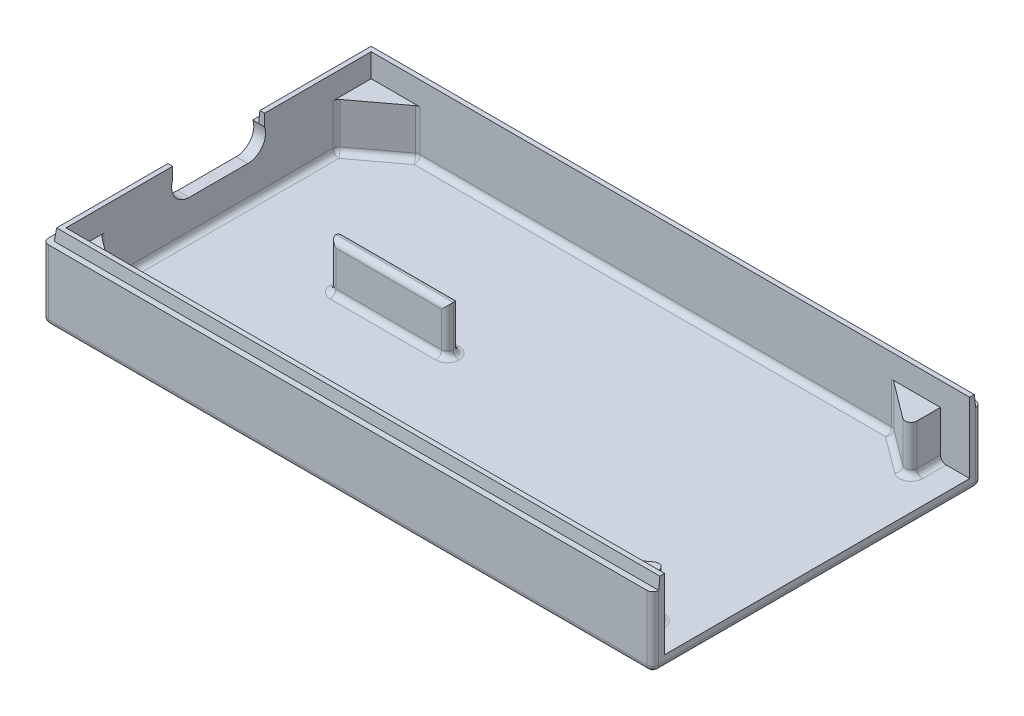
from build123d import *

# Parameters (mm, degrees)
SKETCH_1_W          = 52
SKETCH_1_H          = 28
EXTRUDE_1_DEPTH     = 6
SKETCH_3_W          = 51
SKETCH_3_H          = 26
CUT_EXTRUDE_1_DEPTH = 5
SKETCH_4_W          = 10
SKETCH_4_H          = 1
EXTRUDE_2_DEPTH     = 4
CUT_EXTRUDE_2_REACH = 56.185
FILLET_1_R          = 0.5
EXTRUDE_3_DEPTH     = 1
CHAMFER_1_SIZE      = 0.1
CHAMFER_1_SIZE_2    = 1


# Some blends are built 0.0001 mm under size
with BuildPart() as part:
    # Эскиз1 → Бобышка-Вытянуть1 (new body)
    with BuildSketch(Plane(origin=(0, 0, 0), x_dir=(1, 0, 0), z_dir=(0, 1, 0))):
        Rectangle(SKETCH_1_W, SKETCH_1_H)
    extrude(amount=EXTRUDE_1_DEPTH)

    # Эскиз3 → Вырез-Вытянуть1 (cut)
    with BuildSketch(Plane(origin=(0, 6, 0), x_dir=(1, 0, 0), z_dir=(0, 1, 0))):
        with Locations((0.5, 0)):
            Rectangle(SKETCH_3_W, SKETCH_3_H)
    extrude(amount=-CUT_EXTRUDE_1_DEPTH, mode=Mode.SUBTRACT)

    # Эскиз4 → Бобышка-Вытянуть2 (add)
    with BuildSketch(Plane(origin=(0, 1, 0), x_dir=(1, 0, 0), z_dir=(0, 1, 0))):
        Polygon((19.5, 13), (23.5, 10), (23.5, 13), align=None)
        Polygon((-25, 13), (-25, 10), (-21, 13), align=None)
        Polygon((-21, -13), (-25, -13), (-25, -10), align=None)
        Polygon((23.5, -13), (19.5, -13), (23.5, -10), align=None)
        with Locations((-10, 0)):
            Rectangle(SKETCH_4_W, SKETCH_4_H)
    extrude(amount=EXTRUDE_2_DEPTH)

    # Эскиз5 → Вырез-Вытянуть2 (cut, up to next)
    with BuildSketch(Plane.ZY.offset(26), mode=Mode.PRIVATE) as cut_extrude_2_sk1:
        with BuildLine():
            Line((2.5, 4), (-2.5, 4))
            ThreePointArc((-2.5, 4), (-4, 5.5), (-2.5, 7))
            Line((-2.5, 7), (2.5, 7))
            ThreePointArc((2.5, 7), (4, 5.5), (2.5, 4))
        make_face()
    cut_extrude_2_tool1 = extrude(cut_extrude_2_sk1.sketch, amount=-CUT_EXTRUDE_2_REACH, mode=Mode.PRIVATE) & part.part
    add(cut_extrude_2_tool1.solids().sort_by_distance((-26, 5.5, 0))[0], mode=Mode.SUBTRACT)

    # Скругление1
    fillet_1_edges = [part.edges().sort_by_distance(p)[0] for p in [
        (-26, 3, -14),
        (26, 3, -14),
        (0, 0, -14),
        (-26, 0, 0),
        (-26, 3, 14),
        (26, 0, 0),
        (26, 3, 14),
        (0, 0, 14),
        (-21, 3, 13),
        (-0.75, 1, 13),
        (19.5, 3, 13),
        (-23, 1, -11.5),
        (-25, 1, 0),
        (-23, 1, 11.5),
        (21.5, 1, 11.5),
        (23.5, 1, 11.5),
        (23.5, 1, -11.5),
        (21.5, 1, -11.5),
        (-0.75, 1, -13),
        (-10, 1, -0.5),
        (-5, 1, 0),
        (-10, 1, 0.5),
        (-15, 1, 0),
        (19.5, 3, -13),
        (-21, 3, -13),
        (-25, 3, -10),
        (-25, 3, 10),
        (23.5, 3, 10),
        (23.5, 3, -10),
        (-15, 3, -0.5),
        (-5, 3, -0.5),
        (-10, 5, -0.5),
        (-5, 3, 0.5),
        (-15, 3, 0.5),
        (-10, 5, 0.5),
    ]]
    fillet(fillet_1_edges, radius=FILLET_1_R - 0.0001)  # a hair under: the kernel refuses the full size

    # Эскиз6 → Бобышка-Вытянуть3 (add)
    with BuildSketch(Plane(origin=(0, 6, 0), x_dir=(1, 0, 0), z_dir=(0, 1, 0))):
        Polygon((-25.5, 3.914213562), (-25, 3.914213562), (-25, 13), (26, 13), (26, 13.5), (-25.5, 13.5), align=None)
        Polygon((-25.5, -13.5), (-25.5, -3.914213562), (-25, -3.914213562), (-25, -13), (26, -13), (26, -13.5), align=None)
    extrude(amount=EXTRUDE_3_DEPTH)

    # Фаска1
    # the kernel refuses this chamfer: 1, 0.1 mm, written as the material it takes off along each edge
    with BuildSketch(Plane(origin=(28.599522763, 7, 13.5), x_dir=(0, 0.3574851447578448, -0.9339188247794681), z_dir=(-1, 0, 0))) as chamfer_1_piece_1_section:
        Polygon((CHAMFER_1_SIZE * 0.933918824779, CHAMFER_1_SIZE * 0.357485144758), (-CHAMFER_1_SIZE_2 * 0.357485144758, CHAMFER_1_SIZE_2 * 0.933918824779), (0, 0), align=None)
    chamfer_1_piece_1 = extrude(amount=56.699045526, mode=Mode.PRIVATE)
    chamfer_1_piece_1 = split(chamfer_1_piece_1, bisect_by=Plane(origin=(0.25, 6, 13.477938847), z_dir=(0, 1, 0)), keep=Keep.TOP, mode=Mode.PRIVATE)
    add(chamfer_1_piece_1, mode=Mode.SUBTRACT)
    with BuildSketch(Plane(origin=(-25.5, 7, 16.099522763), x_dir=(-0.003827768713514726, -0.9999926740665033, 0), z_dir=(0, 0, -1))) as chamfer_1_piece_2_section:
        Polygon((CHAMFER_1_SIZE_2 * 0.999992674067, -CHAMFER_1_SIZE_2 * 0.00382776871351), (-CHAMFER_1_SIZE * 0.00382776871351, -CHAMFER_1_SIZE * 0.999992674067), (0, 0), align=None)
    chamfer_1_piece_2 = extrude(amount=14.784831964, mode=Mode.PRIVATE)
    chamfer_1_piece_2 = split(chamfer_1_piece_2, bisect_by=Plane(origin=(-25.477938847, 6, 8.707106781), z_dir=(0, 1, 0)), keep=Keep.TOP, mode=Mode.PRIVATE)
    add(chamfer_1_piece_2, mode=Mode.SUBTRACT)
    with BuildSketch(Plane(origin=(28.599522763, 7, -13.5), x_dir=(0, 0.3574851447578448, 0.9339188247794681), z_dir=(-1, 0, 0))) as chamfer_1_piece_3_section:
        Polygon((CHAMFER_1_SIZE * 0.933918824779, -CHAMFER_1_SIZE * 0.357485144758), (-CHAMFER_1_SIZE_2 * 0.357485144758, -CHAMFER_1_SIZE_2 * 0.933918824779), (0, 0), align=None)
    chamfer_1_piece_3 = extrude(amount=56.699045526, mode=Mode.PRIVATE)
    chamfer_1_piece_3 = split(chamfer_1_piece_3, bisect_by=Plane(origin=(0.25, 6, -13.477938847), z_dir=(0, 1, 0)), keep=Keep.TOP, mode=Mode.PRIVATE)
    add(chamfer_1_piece_3, mode=Mode.SUBTRACT)
    with BuildSketch(Plane(origin=(-25.5, 7, -16.099522763), x_dir=(0.9339188247794681, 0.3574851447578448, 0), z_dir=(0, 0, 1))) as chamfer_1_piece_4_section:
        Polygon((CHAMFER_1_SIZE * 0.933918824779, -CHAMFER_1_SIZE * 0.357485144758), (-CHAMFER_1_SIZE_2 * 0.357485144758, -CHAMFER_1_SIZE_2 * 0.933918824779), (0, 0), align=None)
    chamfer_1_piece_4 = extrude(amount=14.784831964, mode=Mode.PRIVATE)
    chamfer_1_piece_4 = split(chamfer_1_piece_4, bisect_by=Plane(origin=(-25.477938847, 6, -8.707106781), z_dir=(0, 1, 0)), keep=Keep.TOP, mode=Mode.PRIVATE)
    add(chamfer_1_piece_4, mode=Mode.SUBTRACT)


solid = part.part
